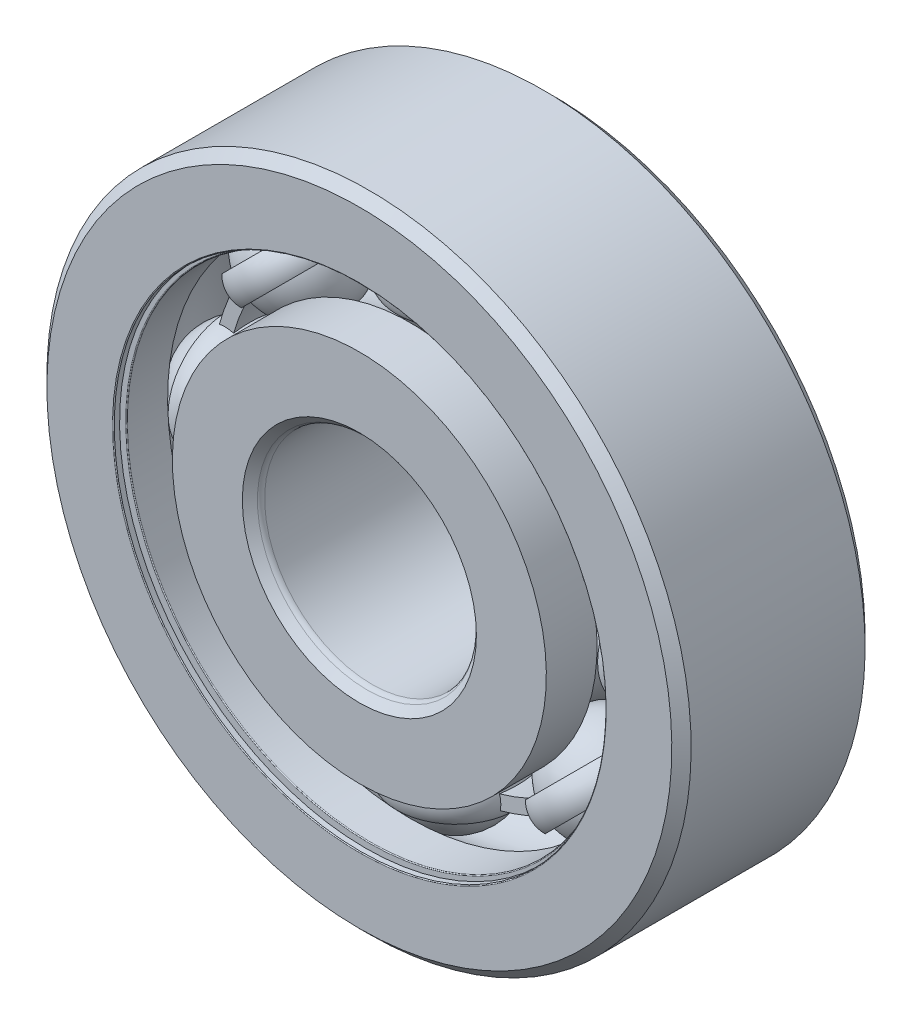
from build123d import *

# Parameters (mm, degrees)
BOSS_EXTRUDE1_DEPTH = 0.75
CIRPATTERN1_COUNT   = 8
CIRPATTERN2_COUNT   = 8
FILLET1_R           = 0.0405
FILLET2_R           = 0.3375


with BuildPart() as part:
    # Sketch3 → Revolve1 (revolve)
    with BuildSketch(Plane(origin=(0, 0, 0), x_dir=(0, 0, -1), z_dir=(1, 0, 0))):
        with BuildLine():
            Line((4.05, 15), (4.5, 14.55))
            Line((4.5, 14.55), (4.5, 11.292307692))
            Line((4.5, 11.292307692), (2.1375, 11.292307692))
            ThreePointArc((2.1375, 11.292307692), (0, 12.497792109), (-2.1375, 11.292307692))
            Line((-2.1375, 11.292307692), (-4.5, 11.292307692))
            Line((-4.5, 11.292307692), (-4.5, 14.55))
            Line((-4.5, 14.55), (-4.05, 15))
            Line((-4.05, 15), (4.05, 15))
        make_face()
    revolve(axis=Axis((0, 0, 4.5), (0, 0, -1)))

    # Sketch8 → Cut-Revolve1 (revolve, cut)
    with BuildSketch(Plane(origin=(0, 0, 0), x_dir=(0, 0, -1), z_dir=(1, 0, 0))):
        Polygon((-4.212, 11.292307692), (-4.05, 11.292307692), (-4.05, 12.528205128), (-4.212, 12.528205128), (-4.212, 11.454307692), (-4.5, 11.454307692), (-4.5, 11.292307692), align=None)
        Polygon((4.05, 11.292307692), (4.212, 11.292307692), (4.5, 11.292307692), (4.5, 11.454307692), (4.212, 11.454307692), (4.212, 12.528205128), (4.05, 12.528205128), align=None)
    revolve(axis=Axis((0, 0, 4.5), (0, 0, -1)), mode=Mode.SUBTRACT)

    # Fillet1
    fillet1_edges = [part.edges().sort_by_distance(p)[0] for p in [
        (0, -11.292307692, -4.05),
        (0, -11.454307692, -4.5),
        (0, -11.292307692, 4.05),
        (0, -11.454307692, 4.5),
    ]]
    fillet(fillet1_edges, radius=FILLET1_R)


with BuildPart() as body_2:
    # Sketch4 → Revolve2 (revolve)
    with BuildSketch(Plane(origin=(0, 0, 0), x_dir=(0, 0, -1), z_dir=(1, 0, 0))):
        with BuildLine():
            Line((-4.05, 5), (-4.5, 5.45))
            Line((-4.5, 5.45), (-4.5, 8.707692308))
            Line((-4.5, 8.707692308), (-2.1375, 8.707692308))
            ThreePointArc((-2.1375, 8.707692308), (0, 7.502207891), (2.1375, 8.707692308))
            Line((2.1375, 8.707692308), (4.5, 8.707692308))
            Line((4.5, 8.707692308), (4.5, 5.45))
            Line((4.5, 5.45), (4.05, 5))
            Line((4.05, 5), (-4.05, 5))
        make_face()
    revolve(axis=Axis((0, 0, 4.5), (0, 0, -1)))

    # Fillet2
    fillet2_edges = [body_2.edges().sort_by_distance(p)[0] for p in [
        (0, -5, -4.05),
        (0, -5, 4.05),
    ]]
    fillet(fillet2_edges, radius=FILLET2_R)


with BuildPart() as body_3:
    # Sketch5 → Revolve3 (revolve)
    with BuildSketch(Plane(origin=(0, 0, 0), x_dir=(0, 0, -1), z_dir=(1, 0, 0))):
        with BuildLine():
            Line((-2.497792109, 10), (2.497792109, 10))
            ThreePointArc((2.497792109, 10), (0, 12.497792109), (-2.497792109, 10))
        make_face()
    revolve(axis=Axis((0, 10, 2.497792109), (0, 0, -1)))


with BuildPart() as body_4:
    # Sketch6 → Revolve4 (revolve)
    with BuildSketch(Plane(origin=(0, 0, 0), x_dir=(0, 0, -1), z_dir=(1, 0, 0))):
        with BuildLine():
            Line((-2.41276825, 10.646153846), (-2.760640208, 10.646153846))
            ThreePointArc((-2.760640208, 10.646153846), (-2.934576188, 10), (-2.760640208, 9.353846154))
            Line((-2.760640208, 9.353846154), (-2.41276825, 9.353846154))
            ThreePointArc((-2.41276825, 9.353846154), (-2.497792109, 10), (-2.41276825, 10.646153846))
        make_face()
    revolve4 = revolve(axis=Axis((0, 15, 0), (0, -1, 0)))

    # Sketch7 → Boss-Extrude1 (add, symmetric)
    with BuildSketch(Plane.XY):
        with BuildLine():
            Line((7.071067812, 7.071067812), (7.527967578, 7.527967578))
            ThreePointArc((7.527967578, 7.527967578), (4.074106695, 9.835763638), (0, 10.646153846))
            Line((0, 10.646153846), (0, 10))
            ThreePointArc((0, 10), (3.826834324, 9.238795325), (7.071067812, 7.071067812))
        make_face()
    boss_extrude1 = extrude(amount=BOSS_EXTRUDE1_DEPTH, both=True)

    # CirPattern2: Revolve4, Boss-Extrude1 ×8 about axis
    cirpattern2_axis = Axis((0, 0, 4.5), (0, 0, -1))
    add([revolve4.rotate(cirpattern2_axis, i * 360 / CIRPATTERN2_COUNT) for i in range(1, CIRPATTERN2_COUNT)])
    add([boss_extrude1.rotate(cirpattern2_axis, i * 360 / CIRPATTERN2_COUNT) for i in range(1, CIRPATTERN2_COUNT)])


with BuildPart() as cirpattern1_1:
    # CirPattern1: pattern copy
    add(body_3.part.rotate(Axis((0, 0, 4.5), (0, 0, -1)), 1 * 360 / CIRPATTERN1_COUNT))


with BuildPart() as cirpattern1_2:
    # CirPattern1: pattern copy
    add(body_3.part.rotate(Axis((0, 0, 4.5), (0, 0, -1)), 2 * 360 / CIRPATTERN1_COUNT))


with BuildPart() as cirpattern1_3:
    # CirPattern1: pattern copy
    add(body_3.part.rotate(Axis((0, 0, 4.5), (0, 0, -1)), 3 * 360 / CIRPATTERN1_COUNT))


with BuildPart() as cirpattern1_4:
    # CirPattern1: pattern copy
    add(body_3.part.rotate(Axis((0, 0, 4.5), (0, 0, -1)), 4 * 360 / CIRPATTERN1_COUNT))


with BuildPart() as cirpattern1_5:
    # CirPattern1: pattern copy
    add(body_3.part.rotate(Axis((0, 0, 4.5), (0, 0, -1)), 5 * 360 / CIRPATTERN1_COUNT))


with BuildPart() as cirpattern1_6:
    # CirPattern1: pattern copy
    add(body_3.part.rotate(Axis((0, 0, 4.5), (0, 0, -1)), 6 * 360 / CIRPATTERN1_COUNT))


with BuildPart() as cirpattern1_7:
    # CirPattern1: pattern copy
    add(body_3.part.rotate(Axis((0, 0, 4.5), (0, 0, -1)), 7 * 360 / CIRPATTERN1_COUNT))


solid = Compound([part.part, body_2.part, body_3.part, body_4.part, cirpattern1_1.part, cirpattern1_2.part, cirpattern1_3.part, cirpattern1_4.part, cirpattern1_5.part, cirpattern1_6.part, cirpattern1_7.part])
